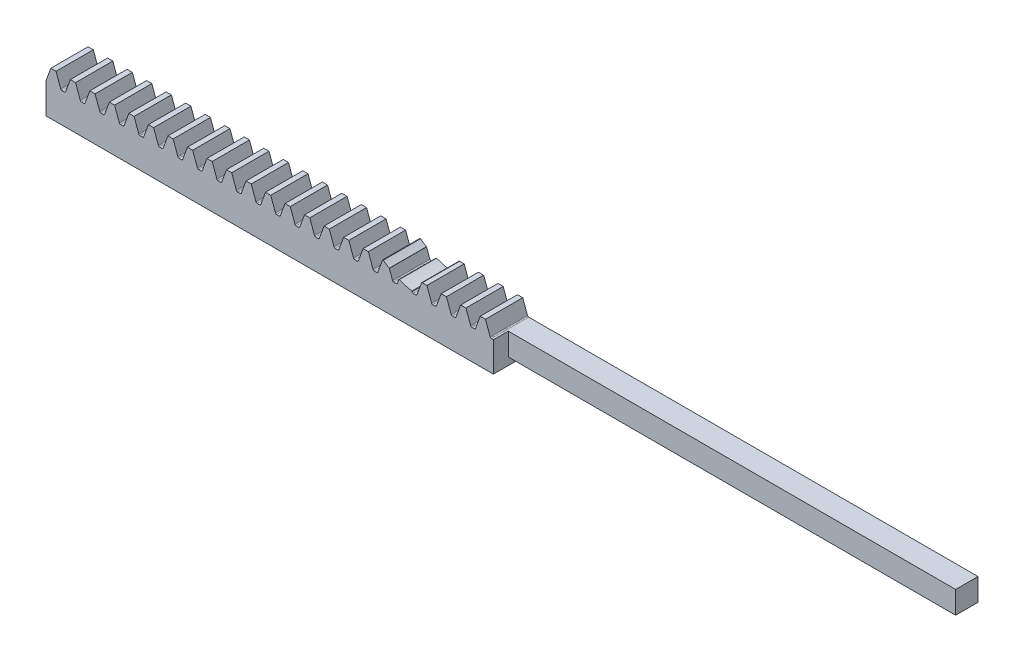
from build123d import *

# Parameters (mm, degrees)
SKETCH1_W                       = 609.6
SKETCH1_H                       = 25.4
BOSS_EXTRUDE1_DEPTH             = 12.7
CUT_EXTRUDE1_DEPTH              = 25.4
FILLET3_R                       = 0.43167355
LPATTERN4_START                 = -12.7
LPATTERN4_DEPTH                 = 25.4
SKETCH5_W                       = 609.6
SKETCH5_H                       = 25.4
CUT_EXTRUDE2_DEPTH              = 10.532533418
SKETCH6_W                       = 609.6
SKETCH6_H                       = 15.910853878
CUT_EXTRUDE3_DEPTH              = 12.7
SKETCH7_W                       = 12.7
SKETCH7_H                       = 14.867466582
CUT_EXTRUDE4_DEPTH              = 457.2
F_1_4_0_25_DIAMETER_HOLE1_D     = 6.35
F_1_4_0_25_DIAMETER_HOLE1_DEPTH = 12.7
F_1_4_0_25_DIAMETER_HOLE1_TIP   = 1.907732465
SKETCH20_W                      = 7.62
SKETCH20_H                      = 7.62
BOSS_EXTRUDE2_DEPTH             = 152.4
CUT_EXTRUDE6_DEPTH              = 12.7
CHAMFER1_SIZE                   = 0.127
CHAMFER1_SIZE2                  = 0.212490963
FILLET4_R                       = 0.127


with BuildPart() as part:
    # Sketch1 → Boss-Extrude1 (new, symmetric)
    with BuildSketch(Plane.XY):
        Rectangle(SKETCH1_W, SKETCH1_H)
    extrude(amount=BOSS_EXTRUDE1_DEPTH, both=True)

    # Sketch2 → Cut-Extrude1 (cut)
    with BuildSketch(Plane.XY.offset(12.7)):
        Polygon((-303.015947325, 12.7), (-301.30256958, 7.992533333), (-299.863657745, 7.992533333), (-298.15028, 12.7), align=None)
    extrude(amount=-CUT_EXTRUDE1_DEPTH, mode=Mode.SUBTRACT)

    # Fillet3
    fillet3_edges = [part.edges().sort_by_distance(p)[0] for p in [
        (-299.863657745, 7.992533333, 0),
        (-301.30256958, 7.992533333, 0),
    ]]
    fillet(fillet3_edges, radius=FILLET3_R)

    # LPattern4: read off the stored shape, not the designer's step
    # LPattern4 outline → LPattern4 (cut)
    with BuildSketch(Plane.XY.offset(LPATTERN4_START)):
        with BuildLine():
            ThreePointArc((-294.756228955, 8.276565834), (-294.598186282, 8.070600612), (-294.350588506, 7.992533333))
            Line((-294.350588506, 7.992533333), (-293.516198819, 7.992533333))
            ThreePointArc((-293.516198819, 7.992533333), (-293.268601043, 8.070600612), (-293.11055837, 8.276565834))
            Line((-293.11055837, 8.276565834), (-291.50056, 12.7))
            Line((-291.50056, 12.7), (-296.366227325, 12.7))
            Line((-296.366227325, 12.7), (-294.756228955, 8.276565834))
        make_face()
        with BuildLine():
            Line((304.8, 12.7), (302.108572675, 12.7))
            Line((302.108572675, 12.7), (303.718571045, 8.276565834))
            ThreePointArc((303.718571045, 8.276565834), (303.876613718, 8.070600612), (304.124211494, 7.992533333))
            Line((304.124211494, 7.992533333), (304.8, 7.992533333))
            Line((304.8, 7.992533333), (304.8, 12.7))
        make_face()
        with BuildLine():
            Line((300.32452, 12.7), (295.458852675, 12.7))
            Line((295.458852675, 12.7), (297.068851045, 8.276565834))
            ThreePointArc((297.068851045, 8.276565834), (297.226893718, 8.070600612), (297.474491494, 7.992533333))
            Line((297.474491494, 7.992533333), (298.308881181, 7.992533333))
            ThreePointArc((298.308881181, 7.992533333), (298.556478957, 8.070600612), (298.71452163, 8.276565834))
            Line((298.71452163, 8.276565834), (300.32452, 12.7))
        make_face()
        with BuildLine():
            Line((293.6748, 12.7), (288.809132675, 12.7))
            Line((288.809132675, 12.7), (290.419131045, 8.276565834))
            ThreePointArc((290.419131045, 8.276565834), (290.577173718, 8.070600612), (290.824771494, 7.992533333))
            Line((290.824771494, 7.992533333), (291.659161181, 7.992533333))
            ThreePointArc((291.659161181, 7.992533333), (291.906758957, 8.070600612), (292.06480163, 8.276565834))
            Line((292.06480163, 8.276565834), (293.6748, 12.7))
        make_face()
        with BuildLine():
            Line((287.02508, 12.7), (282.159412675, 12.7))
            Line((282.159412675, 12.7), (283.769411045, 8.276565834))
            ThreePointArc((283.769411045, 8.276565834), (283.927453718, 8.070600612), (284.175051494, 7.992533333))
            Line((284.175051494, 7.992533333), (285.009441181, 7.992533333))
            ThreePointArc((285.009441181, 7.992533333), (285.257038957, 8.070600612), (285.41508163, 8.276565834))
            Line((285.41508163, 8.276565834), (287.02508, 12.7))
        make_face()
        with BuildLine():
            Line((280.37536, 12.7), (275.509692675, 12.7))
            Line((275.509692675, 12.7), (277.119691045, 8.276565834))
            ThreePointArc((277.119691045, 8.276565834), (277.277733718, 8.070600612), (277.525331494, 7.992533333))
            Line((277.525331494, 7.992533333), (278.359721181, 7.992533333))
            ThreePointArc((278.359721181, 7.992533333), (278.607318957, 8.070600612), (278.76536163, 8.276565834))
            Line((278.76536163, 8.276565834), (280.37536, 12.7))
        make_face()
        with BuildLine():
            Line((273.72564, 12.7), (268.859972675, 12.7))
            Line((268.859972675, 12.7), (270.469971045, 8.276565834))
            ThreePointArc((270.469971045, 8.276565834), (270.628013718, 8.070600612), (270.875611494, 7.992533333))
            Line((270.875611494, 7.992533333), (271.710001181, 7.992533333))
            ThreePointArc((271.710001181, 7.992533333), (271.957598957, 8.070600612), (272.11564163, 8.276565834))
            Line((272.11564163, 8.276565834), (273.72564, 12.7))
        make_face()
        with BuildLine():
            Line((267.07592, 12.7), (262.210252675, 12.7))
            Line((262.210252675, 12.7), (263.820251045, 8.276565834))
            ThreePointArc((263.820251045, 8.276565834), (263.978293718, 8.070600612), (264.225891494, 7.992533333))
            Line((264.225891494, 7.992533333), (265.060281181, 7.992533333))
            ThreePointArc((265.060281181, 7.992533333), (265.307878957, 8.070600612), (265.46592163, 8.276565834))
            Line((265.46592163, 8.276565834), (267.07592, 12.7))
        make_face()
        with BuildLine():
            Line((260.4262, 12.7), (255.560532675, 12.7))
            Line((255.560532675, 12.7), (257.170531045, 8.276565834))
            ThreePointArc((257.170531045, 8.276565834), (257.328573718, 8.070600612), (257.576171494, 7.992533333))
            Line((257.576171494, 7.992533333), (258.410561181, 7.992533333))
            ThreePointArc((258.410561181, 7.992533333), (258.658158957, 8.070600612), (258.81620163, 8.276565834))
            Line((258.81620163, 8.276565834), (260.4262, 12.7))
        make_face()
        with BuildLine():
            Line((253.77648, 12.7), (248.910812675, 12.7))
            Line((248.910812675, 12.7), (250.520811045, 8.276565834))
            ThreePointArc((250.520811045, 8.276565834), (250.678853718, 8.070600612), (250.926451494, 7.992533333))
            Line((250.926451494, 7.992533333), (251.760841181, 7.992533333))
            ThreePointArc((251.760841181, 7.992533333), (252.008438957, 8.070600612), (252.16648163, 8.276565834))
            Line((252.16648163, 8.276565834), (253.77648, 12.7))
        make_face()
        with BuildLine():
            Line((247.12676, 12.7), (242.261092675, 12.7))
            Line((242.261092675, 12.7), (243.871091045, 8.276565834))
            ThreePointArc((243.871091045, 8.276565834), (244.029133718, 8.070600612), (244.276731494, 7.992533333))
            Line((244.276731494, 7.992533333), (245.111121181, 7.992533333))
            ThreePointArc((245.111121181, 7.992533333), (245.358718957, 8.070600612), (245.51676163, 8.276565834))
            Line((245.51676163, 8.276565834), (247.12676, 12.7))
        make_face()
        with BuildLine():
            Line((240.47704, 12.7), (235.611372675, 12.7))
            Line((235.611372675, 12.7), (237.221371045, 8.276565834))
            ThreePointArc((237.221371045, 8.276565834), (237.379413718, 8.070600612), (237.627011494, 7.992533333))
            Line((237.627011494, 7.992533333), (238.461401181, 7.992533333))
            ThreePointArc((238.461401181, 7.992533333), (238.708998957, 8.070600612), (238.86704163, 8.276565834))
            Line((238.86704163, 8.276565834), (240.47704, 12.7))
        make_face()
        with BuildLine():
            Line((233.82732, 12.7), (228.961652675, 12.7))
            Line((228.961652675, 12.7), (230.571651045, 8.276565834))
            ThreePointArc((230.571651045, 8.276565834), (230.729693718, 8.070600612), (230.977291494, 7.992533333))
            Line((230.977291494, 7.992533333), (231.811681181, 7.992533333))
            ThreePointArc((231.811681181, 7.992533333), (232.059278957, 8.070600612), (232.21732163, 8.276565834))
            Line((232.21732163, 8.276565834), (233.82732, 12.7))
        make_face()
        with BuildLine():
            Line((227.1776, 12.7), (222.311932675, 12.7))
            Line((222.311932675, 12.7), (223.921931045, 8.276565834))
            ThreePointArc((223.921931045, 8.276565834), (224.079973718, 8.070600612), (224.327571494, 7.992533333))
            Line((224.327571494, 7.992533333), (225.161961181, 7.992533333))
            ThreePointArc((225.161961181, 7.992533333), (225.409558957, 8.070600612), (225.56760163, 8.276565834))
            Line((225.56760163, 8.276565834), (227.1776, 12.7))
        make_face()
        with BuildLine():
            Line((220.52788, 12.7), (215.662212675, 12.7))
            Line((215.662212675, 12.7), (217.272211045, 8.276565834))
            ThreePointArc((217.272211045, 8.276565834), (217.430253718, 8.070600612), (217.677851494, 7.992533333))
            Line((217.677851494, 7.992533333), (218.512241181, 7.992533333))
            ThreePointArc((218.512241181, 7.992533333), (218.759838957, 8.070600612), (218.91788163, 8.276565834))
            Line((218.91788163, 8.276565834), (220.52788, 12.7))
        make_face()
        with BuildLine():
            Line((213.87816, 12.7), (209.012492675, 12.7))
            Line((209.012492675, 12.7), (210.622491045, 8.276565834))
            ThreePointArc((210.622491045, 8.276565834), (210.780533718, 8.070600612), (211.028131494, 7.992533333))
            Line((211.028131494, 7.992533333), (211.862521181, 7.992533333))
            ThreePointArc((211.862521181, 7.992533333), (212.110118957, 8.070600612), (212.26816163, 8.276565834))
            Line((212.26816163, 8.276565834), (213.87816, 12.7))
        make_face()
        with BuildLine():
            Line((207.22844, 12.7), (202.362772675, 12.7))
            Line((202.362772675, 12.7), (203.972771045, 8.276565834))
            ThreePointArc((203.972771045, 8.276565834), (204.130813718, 8.070600612), (204.378411494, 7.992533333))
            Line((204.378411494, 7.992533333), (205.212801181, 7.992533333))
            ThreePointArc((205.212801181, 7.992533333), (205.460398957, 8.070600612), (205.61844163, 8.276565834))
            Line((205.61844163, 8.276565834), (207.22844, 12.7))
        make_face()
        with BuildLine():
            Line((200.57872, 12.7), (195.713052675, 12.7))
            Line((195.713052675, 12.7), (197.323051045, 8.276565834))
            ThreePointArc((197.323051045, 8.276565834), (197.481093718, 8.070600612), (197.728691494, 7.992533333))
            Line((197.728691494, 7.992533333), (198.563081181, 7.992533333))
            ThreePointArc((198.563081181, 7.992533333), (198.810678957, 8.070600612), (198.96872163, 8.276565834))
            Line((198.96872163, 8.276565834), (200.57872, 12.7))
        make_face()
        with BuildLine():
            Line((193.929, 12.7), (189.063332675, 12.7))
            Line((189.063332675, 12.7), (190.673331045, 8.276565834))
            ThreePointArc((190.673331045, 8.276565834), (190.831373718, 8.070600612), (191.078971494, 7.992533333))
            Line((191.078971494, 7.992533333), (191.913361181, 7.992533333))
            ThreePointArc((191.913361181, 7.992533333), (192.160958957, 8.070600612), (192.31900163, 8.276565834))
            Line((192.31900163, 8.276565834), (193.929, 12.7))
        make_face()
        with BuildLine():
            Line((187.27928, 12.7), (182.413612675, 12.7))
            Line((182.413612675, 12.7), (184.023611045, 8.276565834))
            ThreePointArc((184.023611045, 8.276565834), (184.181653718, 8.070600612), (184.429251494, 7.992533333))
            Line((184.429251494, 7.992533333), (185.263641181, 7.992533333))
            ThreePointArc((185.263641181, 7.992533333), (185.511238957, 8.070600612), (185.66928163, 8.276565834))
            Line((185.66928163, 8.276565834), (187.27928, 12.7))
        make_face()
        with BuildLine():
            Line((180.62956, 12.7), (175.763892675, 12.7))
            Line((175.763892675, 12.7), (177.373891045, 8.276565834))
            ThreePointArc((177.373891045, 8.276565834), (177.531933718, 8.070600612), (177.779531494, 7.992533333))
            Line((177.779531494, 7.992533333), (178.613921181, 7.992533333))
            ThreePointArc((178.613921181, 7.992533333), (178.861518957, 8.070600612), (179.01956163, 8.276565834))
            Line((179.01956163, 8.276565834), (180.62956, 12.7))
        make_face()
        with BuildLine():
            Line((173.97984, 12.7), (169.114172675, 12.7))
            Line((169.114172675, 12.7), (170.724171045, 8.276565834))
            ThreePointArc((170.724171045, 8.276565834), (170.882213718, 8.070600612), (171.129811494, 7.992533333))
            Line((171.129811494, 7.992533333), (171.964201181, 7.992533333))
            ThreePointArc((171.964201181, 7.992533333), (172.211798957, 8.070600612), (172.36984163, 8.276565834))
            Line((172.36984163, 8.276565834), (173.97984, 12.7))
        make_face()
        with BuildLine():
            Line((167.33012, 12.7), (162.464452675, 12.7))
            Line((162.464452675, 12.7), (164.074451045, 8.276565834))
            ThreePointArc((164.074451045, 8.276565834), (164.232493718, 8.070600612), (164.480091494, 7.992533333))
            Line((164.480091494, 7.992533333), (165.314481181, 7.992533333))
            ThreePointArc((165.314481181, 7.992533333), (165.562078957, 8.070600612), (165.72012163, 8.276565834))
            Line((165.72012163, 8.276565834), (167.33012, 12.7))
        make_face()
        with BuildLine():
            Line((160.6804, 12.7), (155.814732675, 12.7))
            Line((155.814732675, 12.7), (157.424731045, 8.276565834))
            ThreePointArc((157.424731045, 8.276565834), (157.582773718, 8.070600612), (157.830371494, 7.992533333))
            Line((157.830371494, 7.992533333), (158.664761181, 7.992533333))
            ThreePointArc((158.664761181, 7.992533333), (158.912358957, 8.070600612), (159.07040163, 8.276565834))
            Line((159.07040163, 8.276565834), (160.6804, 12.7))
        make_face()
        with BuildLine():
            Line((154.03068, 12.7), (149.165012675, 12.7))
            Line((149.165012675, 12.7), (150.775011045, 8.276565834))
            ThreePointArc((150.775011045, 8.276565834), (150.933053718, 8.070600612), (151.180651494, 7.992533333))
            Line((151.180651494, 7.992533333), (152.015041181, 7.992533333))
            ThreePointArc((152.015041181, 7.992533333), (152.262638957, 8.070600612), (152.42068163, 8.276565834))
            Line((152.42068163, 8.276565834), (154.03068, 12.7))
        make_face()
        with BuildLine():
            Line((147.38096, 12.7), (142.515292675, 12.7))
            Line((142.515292675, 12.7), (144.125291045, 8.276565834))
            ThreePointArc((144.125291045, 8.276565834), (144.283333718, 8.070600612), (144.530931494, 7.992533333))
            Line((144.530931494, 7.992533333), (145.365321181, 7.992533333))
            ThreePointArc((145.365321181, 7.992533333), (145.612918957, 8.070600612), (145.77096163, 8.276565834))
            Line((145.77096163, 8.276565834), (147.38096, 12.7))
        make_face()
        with BuildLine():
            Line((140.73124, 12.7), (135.865572675, 12.7))
            Line((135.865572675, 12.7), (137.475571045, 8.276565834))
            ThreePointArc((137.475571045, 8.276565834), (137.633613718, 8.070600612), (137.881211494, 7.992533333))
            Line((137.881211494, 7.992533333), (138.715601181, 7.992533333))
            ThreePointArc((138.715601181, 7.992533333), (138.963198957, 8.070600612), (139.12124163, 8.276565834))
            Line((139.12124163, 8.276565834), (140.73124, 12.7))
        make_face()
        with BuildLine():
            Line((134.08152, 12.7), (129.215852675, 12.7))
            Line((129.215852675, 12.7), (130.825851045, 8.276565834))
            ThreePointArc((130.825851045, 8.276565834), (130.983893718, 8.070600612), (131.231491494, 7.992533333))
            Line((131.231491494, 7.992533333), (132.065881181, 7.992533333))
            ThreePointArc((132.065881181, 7.992533333), (132.313478957, 8.070600612), (132.47152163, 8.276565834))
            Line((132.47152163, 8.276565834), (134.08152, 12.7))
        make_face()
        with BuildLine():
            Line((127.4318, 12.7), (122.566132675, 12.7))
            Line((122.566132675, 12.7), (124.176131045, 8.276565834))
            ThreePointArc((124.176131045, 8.276565834), (124.334173718, 8.070600612), (124.581771494, 7.992533333))
            Line((124.581771494, 7.992533333), (125.416161181, 7.992533333))
            ThreePointArc((125.416161181, 7.992533333), (125.663758957, 8.070600612), (125.82180163, 8.276565834))
            Line((125.82180163, 8.276565834), (127.4318, 12.7))
        make_face()
        with BuildLine():
            Line((120.78208, 12.7), (115.916412675, 12.7))
            Line((115.916412675, 12.7), (117.526411045, 8.276565834))
            ThreePointArc((117.526411045, 8.276565834), (117.684453718, 8.070600612), (117.932051494, 7.992533333))
            Line((117.932051494, 7.992533333), (118.766441181, 7.992533333))
            ThreePointArc((118.766441181, 7.992533333), (119.014038957, 8.070600612), (119.17208163, 8.276565834))
            Line((119.17208163, 8.276565834), (120.78208, 12.7))
        make_face()
        with BuildLine():
            Line((114.13236, 12.7), (109.266692675, 12.7))
            Line((109.266692675, 12.7), (110.876691045, 8.276565834))
            ThreePointArc((110.876691045, 8.276565834), (111.034733718, 8.070600612), (111.282331494, 7.992533333))
            Line((111.282331494, 7.992533333), (112.116721181, 7.992533333))
            ThreePointArc((112.116721181, 7.992533333), (112.364318957, 8.070600612), (112.52236163, 8.276565834))
            Line((112.52236163, 8.276565834), (114.13236, 12.7))
        make_face()
        with BuildLine():
            Line((107.48264, 12.7), (102.616972675, 12.7))
            Line((102.616972675, 12.7), (104.226971045, 8.276565834))
            ThreePointArc((104.226971045, 8.276565834), (104.385013718, 8.070600612), (104.632611494, 7.992533333))
            Line((104.632611494, 7.992533333), (105.467001181, 7.992533333))
            ThreePointArc((105.467001181, 7.992533333), (105.714598957, 8.070600612), (105.87264163, 8.276565834))
            Line((105.87264163, 8.276565834), (107.48264, 12.7))
        make_face()
        with BuildLine():
            Line((100.83292, 12.7), (95.967252675, 12.7))
            Line((95.967252675, 12.7), (97.577251045, 8.276565834))
            ThreePointArc((97.577251045, 8.276565834), (97.735293718, 8.070600612), (97.982891494, 7.992533333))
            Line((97.982891494, 7.992533333), (98.817281181, 7.992533333))
            ThreePointArc((98.817281181, 7.992533333), (99.064878957, 8.070600612), (99.22292163, 8.276565834))
            Line((99.22292163, 8.276565834), (100.83292, 12.7))
        make_face()
        with BuildLine():
            Line((94.1832, 12.7), (89.317532675, 12.7))
            Line((89.317532675, 12.7), (90.927531045, 8.276565834))
            ThreePointArc((90.927531045, 8.276565834), (91.085573718, 8.070600612), (91.333171494, 7.992533333))
            Line((91.333171494, 7.992533333), (92.167561181, 7.992533333))
            ThreePointArc((92.167561181, 7.992533333), (92.415158957, 8.070600612), (92.57320163, 8.276565834))
            Line((92.57320163, 8.276565834), (94.1832, 12.7))
        make_face()
        with BuildLine():
            Line((87.53348, 12.7), (82.667812675, 12.7))
            Line((82.667812675, 12.7), (84.277811045, 8.276565834))
            ThreePointArc((84.277811045, 8.276565834), (84.435853718, 8.070600612), (84.683451494, 7.992533333))
            Line((84.683451494, 7.992533333), (85.517841181, 7.992533333))
            ThreePointArc((85.517841181, 7.992533333), (85.765438957, 8.070600612), (85.92348163, 8.276565834))
            Line((85.92348163, 8.276565834), (87.53348, 12.7))
        make_face()
        with BuildLine():
            Line((80.88376, 12.7), (76.018092675, 12.7))
            Line((76.018092675, 12.7), (77.628091045, 8.276565834))
            ThreePointArc((77.628091045, 8.276565834), (77.786133718, 8.070600612), (78.033731494, 7.992533333))
            Line((78.033731494, 7.992533333), (78.868121181, 7.992533333))
            ThreePointArc((78.868121181, 7.992533333), (79.115718957, 8.070600612), (79.27376163, 8.276565834))
            Line((79.27376163, 8.276565834), (80.88376, 12.7))
        make_face()
        with BuildLine():
            Line((74.23404, 12.7), (69.368372675, 12.7))
            Line((69.368372675, 12.7), (70.978371045, 8.276565834))
            ThreePointArc((70.978371045, 8.276565834), (71.136413718, 8.070600612), (71.384011494, 7.992533333))
            Line((71.384011494, 7.992533333), (72.218401181, 7.992533333))
            ThreePointArc((72.218401181, 7.992533333), (72.465998957, 8.070600612), (72.62404163, 8.276565834))
            Line((72.62404163, 8.276565834), (74.23404, 12.7))
        make_face()
        with BuildLine():
            Line((67.58432, 12.7), (62.718652675, 12.7))
            Line((62.718652675, 12.7), (64.328651045, 8.276565834))
            ThreePointArc((64.328651045, 8.276565834), (64.486693718, 8.070600612), (64.734291494, 7.992533333))
            Line((64.734291494, 7.992533333), (65.568681181, 7.992533333))
            ThreePointArc((65.568681181, 7.992533333), (65.816278957, 8.070600612), (65.97432163, 8.276565834))
            Line((65.97432163, 8.276565834), (67.58432, 12.7))
        make_face()
        with BuildLine():
            Line((60.9346, 12.7), (56.068932675, 12.7))
            Line((56.068932675, 12.7), (57.678931045, 8.276565834))
            ThreePointArc((57.678931045, 8.276565834), (57.836973718, 8.070600612), (58.084571494, 7.992533333))
            Line((58.084571494, 7.992533333), (58.918961181, 7.992533333))
            ThreePointArc((58.918961181, 7.992533333), (59.166558957, 8.070600612), (59.32460163, 8.276565834))
            Line((59.32460163, 8.276565834), (60.9346, 12.7))
        make_face()
        with BuildLine():
            Line((54.28488, 12.7), (49.419212675, 12.7))
            Line((49.419212675, 12.7), (51.029211045, 8.276565834))
            ThreePointArc((51.029211045, 8.276565834), (51.187253718, 8.070600612), (51.434851494, 7.992533333))
            Line((51.434851494, 7.992533333), (52.269241181, 7.992533333))
            ThreePointArc((52.269241181, 7.992533333), (52.516838957, 8.070600612), (52.67488163, 8.276565834))
            Line((52.67488163, 8.276565834), (54.28488, 12.7))
        make_face()
        with BuildLine():
            Line((47.63516, 12.7), (42.769492675, 12.7))
            Line((42.769492675, 12.7), (44.379491045, 8.276565834))
            ThreePointArc((44.379491045, 8.276565834), (44.537533718, 8.070600612), (44.785131494, 7.992533333))
            Line((44.785131494, 7.992533333), (45.619521181, 7.992533333))
            ThreePointArc((45.619521181, 7.992533333), (45.867118957, 8.070600612), (46.02516163, 8.276565834))
            Line((46.02516163, 8.276565834), (47.63516, 12.7))
        make_face()
        with BuildLine():
            Line((40.98544, 12.7), (36.119772675, 12.7))
            Line((36.119772675, 12.7), (37.729771045, 8.276565834))
            ThreePointArc((37.729771045, 8.276565834), (37.887813718, 8.070600612), (38.135411494, 7.992533333))
            Line((38.135411494, 7.992533333), (38.969801181, 7.992533333))
            ThreePointArc((38.969801181, 7.992533333), (39.217398957, 8.070600612), (39.37544163, 8.276565834))
            Line((39.37544163, 8.276565834), (40.98544, 12.7))
        make_face()
        with BuildLine():
            Line((34.33572, 12.7), (29.470052675, 12.7))
            Line((29.470052675, 12.7), (31.080051045, 8.276565834))
            ThreePointArc((31.080051045, 8.276565834), (31.238093718, 8.070600612), (31.485691494, 7.992533333))
            Line((31.485691494, 7.992533333), (32.320081181, 7.992533333))
            ThreePointArc((32.320081181, 7.992533333), (32.567678957, 8.070600612), (32.72572163, 8.276565834))
            Line((32.72572163, 8.276565834), (34.33572, 12.7))
        make_face()
        with BuildLine():
            Line((27.686, 12.7), (22.820332675, 12.7))
            Line((22.820332675, 12.7), (24.430331045, 8.276565834))
            ThreePointArc((24.430331045, 8.276565834), (24.588373718, 8.070600612), (24.835971494, 7.992533333))
            Line((24.835971494, 7.992533333), (25.670361181, 7.992533333))
            ThreePointArc((25.670361181, 7.992533333), (25.917958957, 8.070600612), (26.07600163, 8.276565834))
            Line((26.07600163, 8.276565834), (27.686, 12.7))
        make_face()
        with BuildLine():
            Line((21.03628, 12.7), (16.170612675, 12.7))
            Line((16.170612675, 12.7), (17.780611045, 8.276565834))
            ThreePointArc((17.780611045, 8.276565834), (17.938653718, 8.070600612), (18.186251494, 7.992533333))
            Line((18.186251494, 7.992533333), (19.020641181, 7.992533333))
            ThreePointArc((19.020641181, 7.992533333), (19.268238957, 8.070600612), (19.42628163, 8.276565834))
            Line((19.42628163, 8.276565834), (21.03628, 12.7))
        make_face()
        with BuildLine():
            Line((14.38656, 12.7), (9.520892675, 12.7))
            Line((9.520892675, 12.7), (11.130891045, 8.276565834))
            ThreePointArc((11.130891045, 8.276565834), (11.288933718, 8.070600612), (11.536531494, 7.992533333))
            Line((11.536531494, 7.992533333), (12.370921181, 7.992533333))
            ThreePointArc((12.370921181, 7.992533333), (12.618518957, 8.070600612), (12.77656163, 8.276565834))
            Line((12.77656163, 8.276565834), (14.38656, 12.7))
        make_face()
        with BuildLine():
            Line((7.73684, 12.7), (2.871172675, 12.7))
            Line((2.871172675, 12.7), (4.481171045, 8.276565834))
            ThreePointArc((4.481171045, 8.276565834), (4.639213718, 8.070600612), (4.886811494, 7.992533333))
            Line((4.886811494, 7.992533333), (5.721201181, 7.992533333))
            ThreePointArc((5.721201181, 7.992533333), (5.968798957, 8.070600612), (6.12684163, 8.276565834))
            Line((6.12684163, 8.276565834), (7.73684, 12.7))
        make_face()
        with BuildLine():
            Line((1.08712, 12.7), (-3.778547325, 12.7))
            Line((-3.778547325, 12.7), (-2.168548955, 8.276565834))
            ThreePointArc((-2.168548955, 8.276565834), (-2.010506282, 8.070600612), (-1.762908506, 7.992533333))
            Line((-1.762908506, 7.992533333), (-0.928518819, 7.992533333))
            ThreePointArc((-0.928518819, 7.992533333), (-0.680921043, 8.070600612), (-0.52287837, 8.276565834))
            Line((-0.52287837, 8.276565834), (1.08712, 12.7))
        make_face()
        with BuildLine():
            Line((-5.5626, 12.7), (-10.428267325, 12.7))
            Line((-10.428267325, 12.7), (-8.818268955, 8.276565834))
            ThreePointArc((-8.818268955, 8.276565834), (-8.660226282, 8.070600612), (-8.412628506, 7.992533333))
            Line((-8.412628506, 7.992533333), (-7.578238819, 7.992533333))
            ThreePointArc((-7.578238819, 7.992533333), (-7.330641043, 8.070600612), (-7.17259837, 8.276565834))
            Line((-7.17259837, 8.276565834), (-5.5626, 12.7))
        make_face()
        with BuildLine():
            Line((-12.21232, 12.7), (-17.077987325, 12.7))
            Line((-17.077987325, 12.7), (-15.467988955, 8.276565834))
            ThreePointArc((-15.467988955, 8.276565834), (-15.309946282, 8.070600612), (-15.062348506, 7.992533333))
            Line((-15.062348506, 7.992533333), (-14.227958819, 7.992533333))
            ThreePointArc((-14.227958819, 7.992533333), (-13.980361043, 8.070600612), (-13.82231837, 8.276565834))
            Line((-13.82231837, 8.276565834), (-12.21232, 12.7))
        make_face()
        with BuildLine():
            Line((-18.86204, 12.7), (-23.727707325, 12.7))
            Line((-23.727707325, 12.7), (-22.117708955, 8.276565834))
            ThreePointArc((-22.117708955, 8.276565834), (-21.959666282, 8.070600612), (-21.712068506, 7.992533333))
            Line((-21.712068506, 7.992533333), (-20.877678819, 7.992533333))
            ThreePointArc((-20.877678819, 7.992533333), (-20.630081043, 8.070600612), (-20.47203837, 8.276565834))
            Line((-20.47203837, 8.276565834), (-18.86204, 12.7))
        make_face()
        with BuildLine():
            Line((-25.51176, 12.7), (-30.377427325, 12.7))
            Line((-30.377427325, 12.7), (-28.767428955, 8.276565834))
            ThreePointArc((-28.767428955, 8.276565834), (-28.609386282, 8.070600612), (-28.361788506, 7.992533333))
            Line((-28.361788506, 7.992533333), (-27.527398819, 7.992533333))
            ThreePointArc((-27.527398819, 7.992533333), (-27.279801043, 8.070600612), (-27.12175837, 8.276565834))
            Line((-27.12175837, 8.276565834), (-25.51176, 12.7))
        make_face()
        with BuildLine():
            Line((-32.16148, 12.7), (-37.027147325, 12.7))
            Line((-37.027147325, 12.7), (-35.417148955, 8.276565834))
            ThreePointArc((-35.417148955, 8.276565834), (-35.259106282, 8.070600612), (-35.011508506, 7.992533333))
            Line((-35.011508506, 7.992533333), (-34.177118819, 7.992533333))
            ThreePointArc((-34.177118819, 7.992533333), (-33.929521043, 8.070600612), (-33.77147837, 8.276565834))
            Line((-33.77147837, 8.276565834), (-32.16148, 12.7))
        make_face()
        with BuildLine():
            Line((-38.8112, 12.7), (-43.676867325, 12.7))
            Line((-43.676867325, 12.7), (-42.066868955, 8.276565834))
            ThreePointArc((-42.066868955, 8.276565834), (-41.908826282, 8.070600612), (-41.661228506, 7.992533333))
            Line((-41.661228506, 7.992533333), (-40.826838819, 7.992533333))
            ThreePointArc((-40.826838819, 7.992533333), (-40.579241043, 8.070600612), (-40.42119837, 8.276565834))
            Line((-40.42119837, 8.276565834), (-38.8112, 12.7))
        make_face()
        with BuildLine():
            Line((-45.46092, 12.7), (-50.326587325, 12.7))
            Line((-50.326587325, 12.7), (-48.716588955, 8.276565834))
            ThreePointArc((-48.716588955, 8.276565834), (-48.558546282, 8.070600612), (-48.310948506, 7.992533333))
            Line((-48.310948506, 7.992533333), (-47.476558819, 7.992533333))
            ThreePointArc((-47.476558819, 7.992533333), (-47.228961043, 8.070600612), (-47.07091837, 8.276565834))
            Line((-47.07091837, 8.276565834), (-45.46092, 12.7))
        make_face()
        with BuildLine():
            Line((-52.11064, 12.7), (-56.976307325, 12.7))
            Line((-56.976307325, 12.7), (-55.366308955, 8.276565834))
            ThreePointArc((-55.366308955, 8.276565834), (-55.208266282, 8.070600612), (-54.960668506, 7.992533333))
            Line((-54.960668506, 7.992533333), (-54.126278819, 7.992533333))
            ThreePointArc((-54.126278819, 7.992533333), (-53.878681043, 8.070600612), (-53.72063837, 8.276565834))
            Line((-53.72063837, 8.276565834), (-52.11064, 12.7))
        make_face()
        with BuildLine():
            Line((-58.76036, 12.7), (-63.626027325, 12.7))
            Line((-63.626027325, 12.7), (-62.016028955, 8.276565834))
            ThreePointArc((-62.016028955, 8.276565834), (-61.857986282, 8.070600612), (-61.610388506, 7.992533333))
            Line((-61.610388506, 7.992533333), (-60.775998819, 7.992533333))
            ThreePointArc((-60.775998819, 7.992533333), (-60.528401043, 8.070600612), (-60.37035837, 8.276565834))
            Line((-60.37035837, 8.276565834), (-58.76036, 12.7))
        make_face()
        with BuildLine():
            Line((-65.41008, 12.7), (-70.275747325, 12.7))
            Line((-70.275747325, 12.7), (-68.665748955, 8.276565834))
            ThreePointArc((-68.665748955, 8.276565834), (-68.507706282, 8.070600612), (-68.260108506, 7.992533333))
            Line((-68.260108506, 7.992533333), (-67.425718819, 7.992533333))
            ThreePointArc((-67.425718819, 7.992533333), (-67.178121043, 8.070600612), (-67.02007837, 8.276565834))
            Line((-67.02007837, 8.276565834), (-65.41008, 12.7))
        make_face()
        with BuildLine():
            Line((-72.0598, 12.7), (-76.925467325, 12.7))
            Line((-76.925467325, 12.7), (-75.315468955, 8.276565834))
            ThreePointArc((-75.315468955, 8.276565834), (-75.157426282, 8.070600612), (-74.909828506, 7.992533333))
            Line((-74.909828506, 7.992533333), (-74.075438819, 7.992533333))
            ThreePointArc((-74.075438819, 7.992533333), (-73.827841043, 8.070600612), (-73.66979837, 8.276565834))
            Line((-73.66979837, 8.276565834), (-72.0598, 12.7))
        make_face()
        with BuildLine():
            Line((-78.70952, 12.7), (-83.575187325, 12.7))
            Line((-83.575187325, 12.7), (-81.965188955, 8.276565834))
            ThreePointArc((-81.965188955, 8.276565834), (-81.807146282, 8.070600612), (-81.559548506, 7.992533333))
            Line((-81.559548506, 7.992533333), (-80.725158819, 7.992533333))
            ThreePointArc((-80.725158819, 7.992533333), (-80.477561043, 8.070600612), (-80.31951837, 8.276565834))
            Line((-80.31951837, 8.276565834), (-78.70952, 12.7))
        make_face()
        with BuildLine():
            Line((-85.35924, 12.7), (-90.224907325, 12.7))
            Line((-90.224907325, 12.7), (-88.614908955, 8.276565834))
            ThreePointArc((-88.614908955, 8.276565834), (-88.456866282, 8.070600612), (-88.209268506, 7.992533333))
            Line((-88.209268506, 7.992533333), (-87.374878819, 7.992533333))
            ThreePointArc((-87.374878819, 7.992533333), (-87.127281043, 8.070600612), (-86.96923837, 8.276565834))
            Line((-86.96923837, 8.276565834), (-85.35924, 12.7))
        make_face()
        with BuildLine():
            Line((-92.00896, 12.7), (-96.874627325, 12.7))
            Line((-96.874627325, 12.7), (-95.264628955, 8.276565834))
            ThreePointArc((-95.264628955, 8.276565834), (-95.106586282, 8.070600612), (-94.858988506, 7.992533333))
            Line((-94.858988506, 7.992533333), (-94.024598819, 7.992533333))
            ThreePointArc((-94.024598819, 7.992533333), (-93.777001043, 8.070600612), (-93.61895837, 8.276565834))
            Line((-93.61895837, 8.276565834), (-92.00896, 12.7))
        make_face()
        with BuildLine():
            Line((-98.65868, 12.7), (-103.524347325, 12.7))
            Line((-103.524347325, 12.7), (-101.914348955, 8.276565834))
            ThreePointArc((-101.914348955, 8.276565834), (-101.756306282, 8.070600612), (-101.508708506, 7.992533333))
            Line((-101.508708506, 7.992533333), (-100.674318819, 7.992533333))
            ThreePointArc((-100.674318819, 7.992533333), (-100.426721043, 8.070600612), (-100.26867837, 8.276565834))
            Line((-100.26867837, 8.276565834), (-98.65868, 12.7))
        make_face()
        with BuildLine():
            Line((-105.3084, 12.7), (-110.174067325, 12.7))
            Line((-110.174067325, 12.7), (-108.564068955, 8.276565834))
            ThreePointArc((-108.564068955, 8.276565834), (-108.406026282, 8.070600612), (-108.158428506, 7.992533333))
            Line((-108.158428506, 7.992533333), (-107.324038819, 7.992533333))
            ThreePointArc((-107.324038819, 7.992533333), (-107.076441043, 8.070600612), (-106.91839837, 8.276565834))
            Line((-106.91839837, 8.276565834), (-105.3084, 12.7))
        make_face()
        with BuildLine():
            Line((-111.95812, 12.7), (-116.823787325, 12.7))
            Line((-116.823787325, 12.7), (-115.213788955, 8.276565834))
            ThreePointArc((-115.213788955, 8.276565834), (-115.055746282, 8.070600612), (-114.808148506, 7.992533333))
            Line((-114.808148506, 7.992533333), (-113.973758819, 7.992533333))
            ThreePointArc((-113.973758819, 7.992533333), (-113.726161043, 8.070600612), (-113.56811837, 8.276565834))
            Line((-113.56811837, 8.276565834), (-111.95812, 12.7))
        make_face()
        with BuildLine():
            Line((-118.60784, 12.7), (-123.473507325, 12.7))
            Line((-123.473507325, 12.7), (-121.863508955, 8.276565834))
            ThreePointArc((-121.863508955, 8.276565834), (-121.705466282, 8.070600612), (-121.457868506, 7.992533333))
            Line((-121.457868506, 7.992533333), (-120.623478819, 7.992533333))
            ThreePointArc((-120.623478819, 7.992533333), (-120.375881043, 8.070600612), (-120.21783837, 8.276565834))
            Line((-120.21783837, 8.276565834), (-118.60784, 12.7))
        make_face()
        with BuildLine():
            Line((-125.25756, 12.7), (-130.123227325, 12.7))
            Line((-130.123227325, 12.7), (-128.513228955, 8.276565834))
            ThreePointArc((-128.513228955, 8.276565834), (-128.355186282, 8.070600612), (-128.107588506, 7.992533333))
            Line((-128.107588506, 7.992533333), (-127.273198819, 7.992533333))
            ThreePointArc((-127.273198819, 7.992533333), (-127.025601043, 8.070600612), (-126.86755837, 8.276565834))
            Line((-126.86755837, 8.276565834), (-125.25756, 12.7))
        make_face()
        with BuildLine():
            Line((-131.90728, 12.7), (-136.772947325, 12.7))
            Line((-136.772947325, 12.7), (-135.162948955, 8.276565834))
            ThreePointArc((-135.162948955, 8.276565834), (-135.004906282, 8.070600612), (-134.757308506, 7.992533333))
            Line((-134.757308506, 7.992533333), (-133.922918819, 7.992533333))
            ThreePointArc((-133.922918819, 7.992533333), (-133.675321043, 8.070600612), (-133.51727837, 8.276565834))
            Line((-133.51727837, 8.276565834), (-131.90728, 12.7))
        make_face()
        with BuildLine():
            Line((-138.557, 12.7), (-143.422667325, 12.7))
            Line((-143.422667325, 12.7), (-141.812668955, 8.276565834))
            ThreePointArc((-141.812668955, 8.276565834), (-141.654626282, 8.070600612), (-141.407028506, 7.992533333))
            Line((-141.407028506, 7.992533333), (-140.572638819, 7.992533333))
            ThreePointArc((-140.572638819, 7.992533333), (-140.325041043, 8.070600612), (-140.16699837, 8.276565834))
            Line((-140.16699837, 8.276565834), (-138.557, 12.7))
        make_face()
        with BuildLine():
            Line((-145.20672, 12.7), (-150.072387325, 12.7))
            Line((-150.072387325, 12.7), (-148.462388955, 8.276565834))
            ThreePointArc((-148.462388955, 8.276565834), (-148.304346282, 8.070600612), (-148.056748506, 7.992533333))
            Line((-148.056748506, 7.992533333), (-147.222358819, 7.992533333))
            ThreePointArc((-147.222358819, 7.992533333), (-146.974761043, 8.070600612), (-146.81671837, 8.276565834))
            Line((-146.81671837, 8.276565834), (-145.20672, 12.7))
        make_face()
        with BuildLine():
            Line((-151.85644, 12.7), (-156.722107325, 12.7))
            Line((-156.722107325, 12.7), (-155.112108955, 8.276565834))
            ThreePointArc((-155.112108955, 8.276565834), (-154.954066282, 8.070600612), (-154.706468506, 7.992533333))
            Line((-154.706468506, 7.992533333), (-153.872078819, 7.992533333))
            ThreePointArc((-153.872078819, 7.992533333), (-153.624481043, 8.070600612), (-153.46643837, 8.276565834))
            Line((-153.46643837, 8.276565834), (-151.85644, 12.7))
        make_face()
        with BuildLine():
            Line((-158.50616, 12.7), (-163.371827325, 12.7))
            Line((-163.371827325, 12.7), (-161.761828955, 8.276565834))
            ThreePointArc((-161.761828955, 8.276565834), (-161.603786282, 8.070600612), (-161.356188506, 7.992533333))
            Line((-161.356188506, 7.992533333), (-160.521798819, 7.992533333))
            ThreePointArc((-160.521798819, 7.992533333), (-160.274201043, 8.070600612), (-160.11615837, 8.276565834))
            Line((-160.11615837, 8.276565834), (-158.50616, 12.7))
        make_face()
        with BuildLine():
            Line((-165.15588, 12.7), (-170.021547325, 12.7))
            Line((-170.021547325, 12.7), (-168.411548955, 8.276565834))
            ThreePointArc((-168.411548955, 8.276565834), (-168.253506282, 8.070600612), (-168.005908506, 7.992533333))
            Line((-168.005908506, 7.992533333), (-167.171518819, 7.992533333))
            ThreePointArc((-167.171518819, 7.992533333), (-166.923921043, 8.070600612), (-166.76587837, 8.276565834))
            Line((-166.76587837, 8.276565834), (-165.15588, 12.7))
        make_face()
        with BuildLine():
            Line((-171.8056, 12.7), (-176.671267325, 12.7))
            Line((-176.671267325, 12.7), (-175.061268955, 8.276565834))
            ThreePointArc((-175.061268955, 8.276565834), (-174.903226282, 8.070600612), (-174.655628506, 7.992533333))
            Line((-174.655628506, 7.992533333), (-173.821238819, 7.992533333))
            ThreePointArc((-173.821238819, 7.992533333), (-173.573641043, 8.070600612), (-173.41559837, 8.276565834))
            Line((-173.41559837, 8.276565834), (-171.8056, 12.7))
        make_face()
        with BuildLine():
            Line((-178.45532, 12.7), (-183.320987325, 12.7))
            Line((-183.320987325, 12.7), (-181.710988955, 8.276565834))
            ThreePointArc((-181.710988955, 8.276565834), (-181.552946282, 8.070600612), (-181.305348506, 7.992533333))
            Line((-181.305348506, 7.992533333), (-180.470958819, 7.992533333))
            ThreePointArc((-180.470958819, 7.992533333), (-180.223361043, 8.070600612), (-180.06531837, 8.276565834))
            Line((-180.06531837, 8.276565834), (-178.45532, 12.7))
        make_face()
        with BuildLine():
            Line((-185.10504, 12.7), (-189.970707325, 12.7))
            Line((-189.970707325, 12.7), (-188.360708955, 8.276565834))
            ThreePointArc((-188.360708955, 8.276565834), (-188.202666282, 8.070600612), (-187.955068506, 7.992533333))
            Line((-187.955068506, 7.992533333), (-187.120678819, 7.992533333))
            ThreePointArc((-187.120678819, 7.992533333), (-186.873081043, 8.070600612), (-186.71503837, 8.276565834))
            Line((-186.71503837, 8.276565834), (-185.10504, 12.7))
        make_face()
        with BuildLine():
            Line((-191.75476, 12.7), (-196.620427325, 12.7))
            Line((-196.620427325, 12.7), (-195.010428955, 8.276565834))
            ThreePointArc((-195.010428955, 8.276565834), (-194.852386282, 8.070600612), (-194.604788506, 7.992533333))
            Line((-194.604788506, 7.992533333), (-193.770398819, 7.992533333))
            ThreePointArc((-193.770398819, 7.992533333), (-193.522801043, 8.070600612), (-193.36475837, 8.276565834))
            Line((-193.36475837, 8.276565834), (-191.75476, 12.7))
        make_face()
        with BuildLine():
            Line((-198.40448, 12.7), (-203.270147325, 12.7))
            Line((-203.270147325, 12.7), (-201.660148955, 8.276565834))
            ThreePointArc((-201.660148955, 8.276565834), (-201.502106282, 8.070600612), (-201.254508506, 7.992533333))
            Line((-201.254508506, 7.992533333), (-200.420118819, 7.992533333))
            ThreePointArc((-200.420118819, 7.992533333), (-200.172521043, 8.070600612), (-200.01447837, 8.276565834))
            Line((-200.01447837, 8.276565834), (-198.40448, 12.7))
        make_face()
        with BuildLine():
            Line((-205.0542, 12.7), (-209.919867325, 12.7))
            Line((-209.919867325, 12.7), (-208.309868955, 8.276565834))
            ThreePointArc((-208.309868955, 8.276565834), (-208.151826282, 8.070600612), (-207.904228506, 7.992533333))
            Line((-207.904228506, 7.992533333), (-207.069838819, 7.992533333))
            ThreePointArc((-207.069838819, 7.992533333), (-206.822241043, 8.070600612), (-206.66419837, 8.276565834))
            Line((-206.66419837, 8.276565834), (-205.0542, 12.7))
        make_face()
        with BuildLine():
            Line((-211.70392, 12.7), (-216.569587325, 12.7))
            Line((-216.569587325, 12.7), (-214.959588955, 8.276565834))
            ThreePointArc((-214.959588955, 8.276565834), (-214.801546282, 8.070600612), (-214.553948506, 7.992533333))
            Line((-214.553948506, 7.992533333), (-213.719558819, 7.992533333))
            ThreePointArc((-213.719558819, 7.992533333), (-213.471961043, 8.070600612), (-213.31391837, 8.276565834))
            Line((-213.31391837, 8.276565834), (-211.70392, 12.7))
        make_face()
        with BuildLine():
            Line((-218.35364, 12.7), (-223.219307325, 12.7))
            Line((-223.219307325, 12.7), (-221.609308955, 8.276565834))
            ThreePointArc((-221.609308955, 8.276565834), (-221.451266282, 8.070600612), (-221.203668506, 7.992533333))
            Line((-221.203668506, 7.992533333), (-220.369278819, 7.992533333))
            ThreePointArc((-220.369278819, 7.992533333), (-220.121681043, 8.070600612), (-219.96363837, 8.276565834))
            Line((-219.96363837, 8.276565834), (-218.35364, 12.7))
        make_face()
        with BuildLine():
            Line((-225.00336, 12.7), (-229.869027325, 12.7))
            Line((-229.869027325, 12.7), (-228.259028955, 8.276565834))
            ThreePointArc((-228.259028955, 8.276565834), (-228.100986282, 8.070600612), (-227.853388506, 7.992533333))
            Line((-227.853388506, 7.992533333), (-227.018998819, 7.992533333))
            ThreePointArc((-227.018998819, 7.992533333), (-226.771401043, 8.070600612), (-226.61335837, 8.276565834))
            Line((-226.61335837, 8.276565834), (-225.00336, 12.7))
        make_face()
        with BuildLine():
            Line((-231.65308, 12.7), (-236.518747325, 12.7))
            Line((-236.518747325, 12.7), (-234.908748955, 8.276565834))
            ThreePointArc((-234.908748955, 8.276565834), (-234.750706282, 8.070600612), (-234.503108506, 7.992533333))
            Line((-234.503108506, 7.992533333), (-233.668718819, 7.992533333))
            ThreePointArc((-233.668718819, 7.992533333), (-233.421121043, 8.070600612), (-233.26307837, 8.276565834))
            Line((-233.26307837, 8.276565834), (-231.65308, 12.7))
        make_face()
        with BuildLine():
            Line((-238.3028, 12.7), (-243.168467325, 12.7))
            Line((-243.168467325, 12.7), (-241.558468955, 8.276565834))
            ThreePointArc((-241.558468955, 8.276565834), (-241.400426282, 8.070600612), (-241.152828506, 7.992533333))
            Line((-241.152828506, 7.992533333), (-240.318438819, 7.992533333))
            ThreePointArc((-240.318438819, 7.992533333), (-240.070841043, 8.070600612), (-239.91279837, 8.276565834))
            Line((-239.91279837, 8.276565834), (-238.3028, 12.7))
        make_face()
        with BuildLine():
            Line((-244.95252, 12.7), (-249.818187325, 12.7))
            Line((-249.818187325, 12.7), (-248.208188955, 8.276565834))
            ThreePointArc((-248.208188955, 8.276565834), (-248.050146282, 8.070600612), (-247.802548506, 7.992533333))
            Line((-247.802548506, 7.992533333), (-246.968158819, 7.992533333))
            ThreePointArc((-246.968158819, 7.992533333), (-246.720561043, 8.070600612), (-246.56251837, 8.276565834))
            Line((-246.56251837, 8.276565834), (-244.95252, 12.7))
        make_face()
        with BuildLine():
            Line((-251.60224, 12.7), (-256.467907325, 12.7))
            Line((-256.467907325, 12.7), (-254.857908955, 8.276565834))
            ThreePointArc((-254.857908955, 8.276565834), (-254.699866282, 8.070600612), (-254.452268506, 7.992533333))
            Line((-254.452268506, 7.992533333), (-253.617878819, 7.992533333))
            ThreePointArc((-253.617878819, 7.992533333), (-253.370281043, 8.070600612), (-253.21223837, 8.276565834))
            Line((-253.21223837, 8.276565834), (-251.60224, 12.7))
        make_face()
        with BuildLine():
            Line((-258.25196, 12.7), (-263.117627325, 12.7))
            Line((-263.117627325, 12.7), (-261.507628955, 8.276565834))
            ThreePointArc((-261.507628955, 8.276565834), (-261.349586282, 8.070600612), (-261.101988506, 7.992533333))
            Line((-261.101988506, 7.992533333), (-260.267598819, 7.992533333))
            ThreePointArc((-260.267598819, 7.992533333), (-260.020001043, 8.070600612), (-259.86195837, 8.276565834))
            Line((-259.86195837, 8.276565834), (-258.25196, 12.7))
        make_face()
        with BuildLine():
            Line((-264.90168, 12.7), (-269.767347325, 12.7))
            Line((-269.767347325, 12.7), (-268.157348955, 8.276565834))
            ThreePointArc((-268.157348955, 8.276565834), (-267.999306282, 8.070600612), (-267.751708506, 7.992533333))
            Line((-267.751708506, 7.992533333), (-266.917318819, 7.992533333))
            ThreePointArc((-266.917318819, 7.992533333), (-266.669721043, 8.070600612), (-266.51167837, 8.276565834))
            Line((-266.51167837, 8.276565834), (-264.90168, 12.7))
        make_face()
        with BuildLine():
            Line((-271.5514, 12.7), (-276.417067325, 12.7))
            Line((-276.417067325, 12.7), (-274.807068955, 8.276565834))
            ThreePointArc((-274.807068955, 8.276565834), (-274.649026282, 8.070600612), (-274.401428506, 7.992533333))
            Line((-274.401428506, 7.992533333), (-273.567038819, 7.992533333))
            ThreePointArc((-273.567038819, 7.992533333), (-273.319441043, 8.070600612), (-273.16139837, 8.276565834))
            Line((-273.16139837, 8.276565834), (-271.5514, 12.7))
        make_face()
        with BuildLine():
            Line((-278.20112, 12.7), (-283.066787325, 12.7))
            Line((-283.066787325, 12.7), (-281.456788955, 8.276565834))
            ThreePointArc((-281.456788955, 8.276565834), (-281.298746282, 8.070600612), (-281.051148506, 7.992533333))
            Line((-281.051148506, 7.992533333), (-280.216758819, 7.992533333))
            ThreePointArc((-280.216758819, 7.992533333), (-279.969161043, 8.070600612), (-279.81111837, 8.276565834))
            Line((-279.81111837, 8.276565834), (-278.20112, 12.7))
        make_face()
        with BuildLine():
            Line((-284.85084, 12.7), (-289.716507325, 12.7))
            Line((-289.716507325, 12.7), (-288.106508955, 8.276565834))
            ThreePointArc((-288.106508955, 8.276565834), (-287.948466282, 8.070600612), (-287.700868506, 7.992533333))
            Line((-287.700868506, 7.992533333), (-286.866478819, 7.992533333))
            ThreePointArc((-286.866478819, 7.992533333), (-286.618881043, 8.070600612), (-286.46083837, 8.276565834))
            Line((-286.46083837, 8.276565834), (-284.85084, 12.7))
        make_face()
    extrude(amount=LPATTERN4_DEPTH, mode=Mode.SUBTRACT)

    # Sketch5 → Cut-Extrude2 (cut)
    with BuildSketch(Plane.XZ.offset(12.7)):
        Rectangle(SKETCH5_W, SKETCH5_H)
    extrude(amount=-CUT_EXTRUDE2_DEPTH, mode=Mode.SUBTRACT)

    # Sketch6 → Cut-Extrude3 (cut)
    with BuildSketch(Plane.XY.offset(12.7)):
        with Locations((0, 5.787960357)):
            Rectangle(SKETCH6_W, SKETCH6_H)
    extrude(amount=-CUT_EXTRUDE3_DEPTH, mode=Mode.SUBTRACT)

    # Sketch7 → Cut-Extrude4 (cut)
    with BuildSketch(Plane.ZY.offset(304.8)):
        with Locations((-6.35, 5.266266709)):
            Rectangle(SKETCH7_W, SKETCH7_H)
    extrude(amount=-CUT_EXTRUDE4_DEPTH, mode=Mode.SUBTRACT)

    # 1/4 (0.25) Diameter Hole1
    with Locations(Plane.ZY.offset(-152.4)):
        with Locations((-6.35, 4.182533418)):
            Hole(F_1_4_0_25_DIAMETER_HOLE1_D / 2, depth=F_1_4_0_25_DIAMETER_HOLE1_DEPTH)
            with Locations((0, 0, -(F_1_4_0_25_DIAMETER_HOLE1_DEPTH + F_1_4_0_25_DIAMETER_HOLE1_TIP / 2))):  # 118° drill point
                Cone(0, F_1_4_0_25_DIAMETER_HOLE1_D / 2, F_1_4_0_25_DIAMETER_HOLE1_TIP, mode=Mode.SUBTRACT)

    # Sketch20 → Boss-Extrude2 (add)
    with BuildSketch(Plane(origin=(304.8, 0, 0), x_dir=(0, 0, -1), z_dir=(1, 0, 0))):
        with Locations((8.89, 4.182533333)):
            Rectangle(SKETCH20_W, SKETCH20_H)
    extrude(amount=BOSS_EXTRUDE2_DEPTH)

    # Sketch24 → Cut-Extrude6 (cut)
    with BuildSketch(Plane.XY):
        with BuildLine():
            ThreePointArc((277.657315225, 57.182376248), (257.033063457, 32.766), (277.657315225, 8.349623752))
            Line((277.657315225, 8.349623752), (277.657315225, 57.182376248))
        make_face()
    extrude(amount=-CUT_EXTRUDE6_DEPTH, mode=Mode.SUBTRACT)

    # Chamfer1
    chamfer1_edges = [part.edges().sort_by_distance(p)[0] for p in [
        (280.37536, 12.7, -6.35),
    ]]
    chamfer1_side = [part.faces().sort_by_distance(p)[0] for p in [
        (279.570360815, 10.488282917, -6.35),
    ]]
    chamfer(chamfer1_edges, length=CHAMFER1_SIZE, length2=CHAMFER1_SIZE2, reference=chamfer1_side[0])

    # Fillet4
    fillet4_edges = [part.edges().sort_by_distance(p)[0] for p in [
        (277.052985016, 8.459839144, -6.35),
        (269.34851947, 11.357728713, -6.35),
        (272.652499988, 9.751572051, -6.35),
    ]]
    fillet(fillet4_edges, radius=FILLET4_R)


solid = part.part
